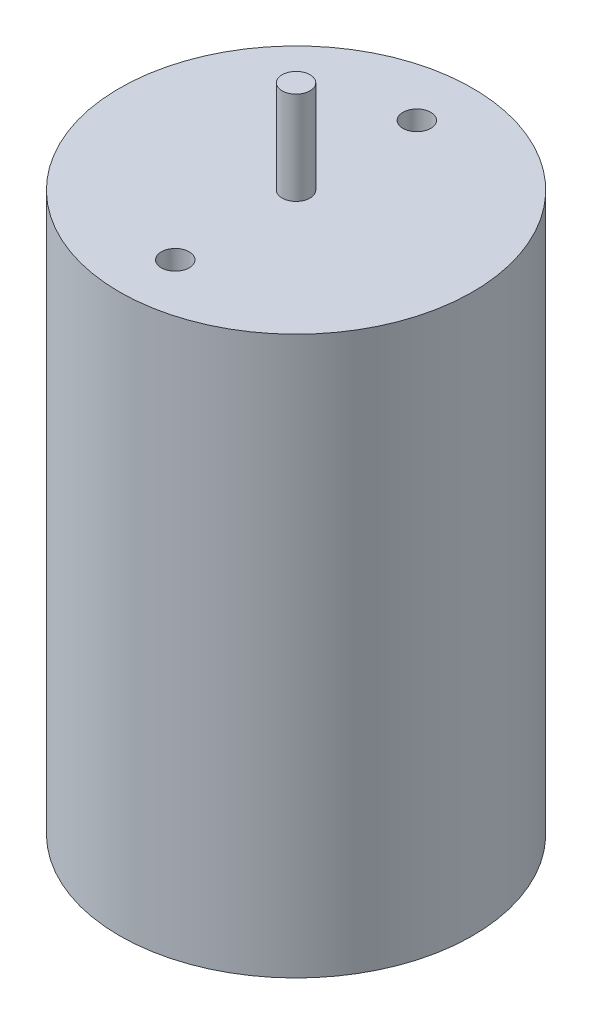
from build123d import *

# Parameters (mm, degrees)
SKETCH1_R           = 19
BOSS_EXTRUDE1_DEPTH = 60
SKETCH2_R           = 1.5
BOSS_EXTRUDE2_DEPTH = 10
SKETCH3_R           = 1.5
CUT_EXTRUDE1_DEPTH  = 10


with BuildPart() as part:
    # Sketch1 → Boss-Extrude1 (new body)
    with BuildSketch(Plane(origin=(0, 0, 0), x_dir=(1, 0, 0), z_dir=(0, 1, 0))):
        Circle(SKETCH1_R)
    extrude(amount=BOSS_EXTRUDE1_DEPTH)

    # Sketch2 → Boss-Extrude2 (add)
    with BuildSketch(Plane(origin=(0, 60, 0), x_dir=(1, 0, 0), z_dir=(0, 1, 0))):
        Circle(SKETCH2_R)
    extrude(amount=BOSS_EXTRUDE2_DEPTH)

    # Sketch3 → Cut-Extrude1 (cut)
    with BuildSketch(Plane(origin=(0, 60, 0), x_dir=(1, 0, 0), z_dir=(0, 1, 0))):
        with Locations((0, -13)):
            Circle(SKETCH3_R)
        with Locations((0, 13)):
            Circle(SKETCH3_R)
    extrude(amount=-CUT_EXTRUDE1_DEPTH, mode=Mode.SUBTRACT)


solid = part.part
